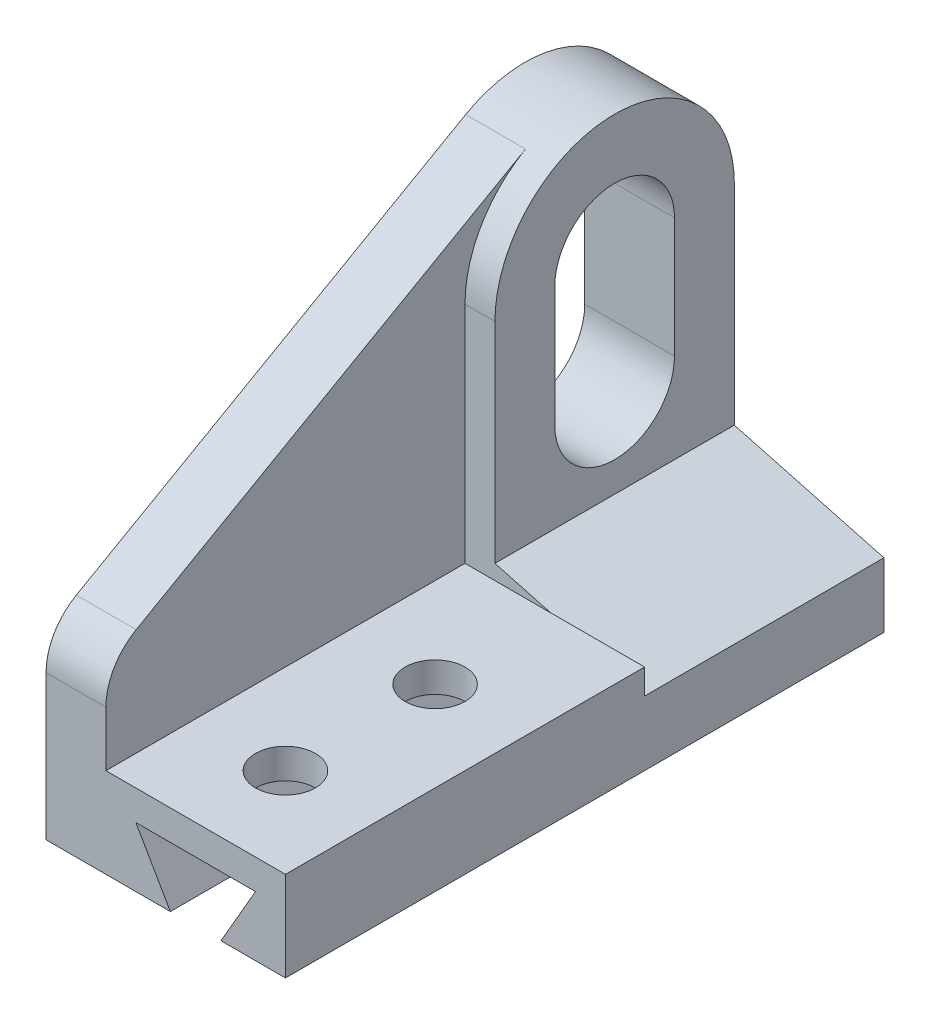
from build123d import *

# Parameters (mm, degrees)
BOSS_EXTRUDE1_DEPTH = 12.7
BOSS_EXTRUDE2_DEPTH = 50.8
BOSS_EXTRUDE3_DEPTH = 19.05
CUT_EXTRUDE1_DEPTH  = 165.886159592
SKETCH4_R           = 6.35
CUT_EXTRUDE2_DEPTH  = 156.055766178
CUT_EXTRUDE3_DEPTH  = 50.8


with BuildPart() as part:
    # Sketch1 → Boss-Extrude1 (new body)
    with BuildSketch(Plane(origin=(0, 0, 0), x_dir=(0, 0, -1), z_dir=(1, 0, 0))):
        with BuildLine():
            Line((0, 0), (127, 0))
            Line((127, 0), (127, 66.675))
            ThreePointArc((127, 66.675), (114.370135783, 88.631402986), (89.04065889, 88.752657278))
            Line((89.04065889, 88.752657278), (6.420329445, 41.752339853))
            ThreePointArc((6.420329445, 41.752339853), (1.721798507, 37.098579105), (0, 30.713511214))
            Line((0, 30.713511214), (0, 0))
        make_face()
        with BuildLine():
            Line((88.9, 41.275), (88.9, 66.675))
            ThreePointArc((88.9, 66.675), (101.6, 79.375), (114.3, 66.675))
            Line((114.3, 66.675), (114.3, 41.275))
            ThreePointArc((114.3, 41.275), (101.6, 28.575), (88.9, 41.275))
        make_face(mode=Mode.SUBTRACT)
    extrude(amount=BOSS_EXTRUDE1_DEPTH)

    # Sketch1<3> → Boss-Extrude2 (add)
    with BuildSketch(Plane(origin=(0, 0, 0), x_dir=(0, 0, -1), z_dir=(1, 0, 0))):
        Polygon((0, 19.05), (0, 0), (127, 0), (127, 22.225), (76.2, 22.225), (76.2, 19.05), align=None)
    extrude(amount=BOSS_EXTRUDE2_DEPTH)

    # Sketch1<7> → Boss-Extrude3 (add)
    with BuildSketch(Plane(origin=(0, 0, 0), x_dir=(0, 0, -1), z_dir=(1, 0, 0))):
        with BuildLine():
            Line((76.2, 22.225), (127, 22.225))
            Line((127, 22.225), (127, 66.675))
            ThreePointArc((127, 66.675), (114.370135783, 88.631402986), (89.04065889, 88.752657278))
            ThreePointArc((89.04065889, 88.752657278), (79.643597014, 79.445135783), (76.2, 66.675))
            Line((76.2, 66.675), (76.2, 22.225))
        make_face()
        with BuildLine():
            ThreePointArc((114.3, 41.275), (101.6, 28.575), (88.9, 41.275))
            Line((88.9, 41.275), (88.9, 66.675))
            ThreePointArc((88.9, 66.675), (101.6, 79.375), (114.3, 66.675))
            Line((114.3, 66.675), (114.3, 41.275))
        make_face(mode=Mode.SUBTRACT)
    extrude(amount=BOSS_EXTRUDE3_DEPTH)

    # Sketch3 → Cut-Extrude1 (cut, through all)
    with BuildSketch(Plane.XY):
        Polygon((-67.157348715, -180.609598473), (37.117651581, 0), (44.45, 12.7), (19.05, 12.7), (26.382348419, 0), (130.657348715, -180.609598473), (130.657348715, 236.490402714), (-67.157348715, 236.490402714), align=None)
    extrude(amount=-CUT_EXTRUDE1_DEPTH, mode=Mode.SUBTRACT)

    # Sketch4 → Cut-Extrude2 (cut, through all)
    with BuildSketch(Plane(origin=(0, 19.05, 0), x_dir=(1, 0, 0), z_dir=(0, 1, 0))):
        with Locations((31.75, 19.05)):
            Circle(SKETCH4_R)
        with Locations((31.75, 50.8)):
            Circle(SKETCH4_R)
    extrude(amount=-CUT_EXTRUDE2_DEPTH, mode=Mode.SUBTRACT)

    # Sketch5 → Cut-Extrude3 (cut)
    with BuildSketch(Plane(origin=(0, 0, -127), x_dir=(-1, 0, 0), z_dir=(0, 0, -1))):
        Polygon((-19.05, 22.225), (-50.8, 13.71761314), (-50.8, 22.225), align=None)
    extrude(amount=-CUT_EXTRUDE3_DEPTH, mode=Mode.SUBTRACT)


solid = part.part
